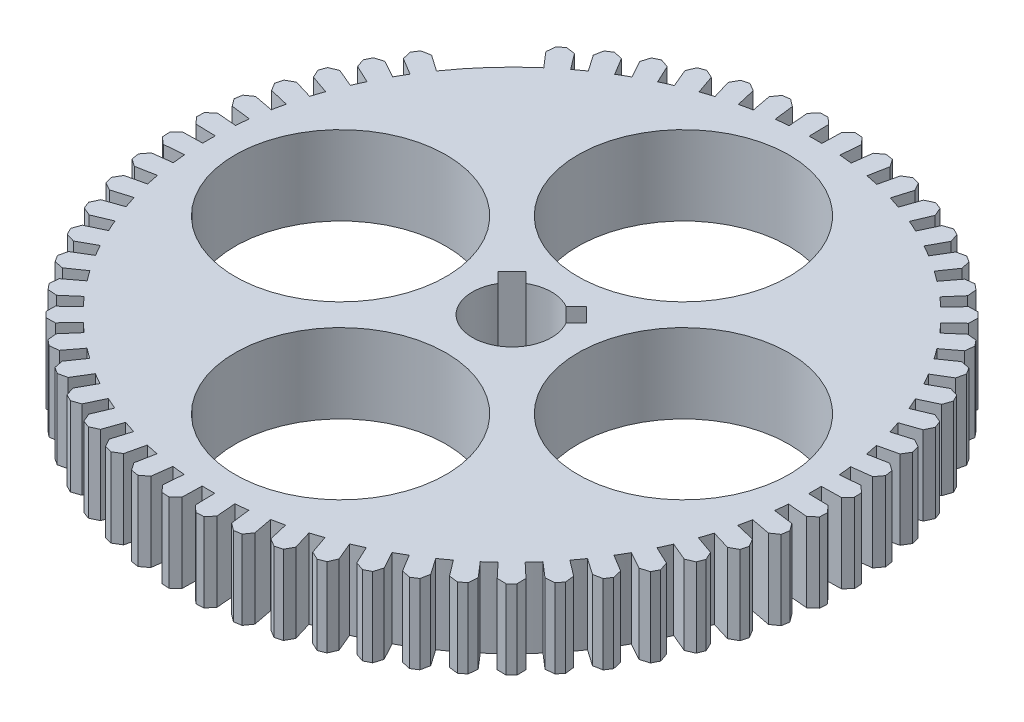
from build123d import *

# Parameters (mm, degrees)
SKETCH1_R           = 36.5125
SKETCH1_R_2         = 12.7
BOSS_EXTRUDE1_DEPTH = 9.525
EXTRUDE_THIN1_START = -9.525
EXTRUDE_THIN1_DEPTH = 9.525


# Read off the part's stored shape, not the designer's step: Extrude-Thin1
with BuildPart() as part:
    # Sketch1 → Boss-Extrude1 (new body)
    with BuildSketch(Plane(origin=(0, 0, 0), x_dir=(1, 0, 0), z_dir=(0, 1, 0))):
        with Locations(Location((0, 0, 0), (0, 0, 90))):
            Circle(SKETCH1_R)
        with Locations(Location((0, -20.6375, 0), (0, 0, 90))):
            Circle(SKETCH1_R_2, mode=Mode.SUBTRACT)
        with Locations(Location((-20.6375, 0, 0), (0, 0, 90))):
            Circle(SKETCH1_R_2, mode=Mode.SUBTRACT)
        with BuildLine():
            Line((2.418761839, 4.102559861), (3.648229049, 5.332027072))
            Line((3.648229049, 5.332027072), (5.332027072, 3.648229049))
            Line((5.332027072, 3.648229049), (4.102559861, 2.418761839))
            ThreePointArc((4.102559861, 2.418761839), (4.59455371, 1.253587833), (4.7625, 0))
            ThreePointArc((4.7625, 0), (-1.253587833, -4.59455371), (-4.102559861, 2.418761839))
            Line((-4.102559861, 2.418761839), (-5.332027072, 3.648229049))
            Line((-5.332027072, 3.648229049), (-3.648229049, 5.332027072))
            Line((-3.648229049, 5.332027072), (-2.418761839, 4.102559861))
            ThreePointArc((-2.418761839, 4.102559861), (0, 4.7625), (2.418761839, 4.102559861))
        make_face(mode=Mode.SUBTRACT)
        with Locations(Location((20.6375, 0, 0), (0, 0, 90))):
            Circle(SKETCH1_R_2, mode=Mode.SUBTRACT)
        with Locations(Location((0, 20.6375, 0), (0, 0, 90))):
            Circle(SKETCH1_R_2, mode=Mode.SUBTRACT)
    extrude(amount=BOSS_EXTRUDE1_DEPTH)

    # Extrude-Thin1 outline → Extrude-Thin1 (add)
    with BuildSketch(Plane(origin=(0, 9.525, 0), x_dir=(1, 0, 0), z_dir=(0, 1, 0)).offset(EXTRUDE_THIN1_START)):
        with BuildLine():
            Line((-17.569879945, 35.567425081), (-18.384318942, 35.153367195))
            Line((-18.384318942, 35.153367195), (-18.710040661, 34.097773645))
            Line((-18.710040661, 34.097773645), (-17.564527967, 32.01015485))
            ThreePointArc((-17.564527967, 32.01015485), (-16.547148477, 32.54772701), (-15.513335009, 33.052974044))
            Line((-15.513335009, 33.052974044), (-16.525074249, 35.208602786))
            Line((-16.525074249, 35.208602786), (-17.569879945, 35.567425081))
        make_face()
        with BuildLine():
            ThreePointArc((-20.814279941, 29.998806756), (-19.858665354, 30.639779154), (-18.88332792, 31.250321325))
            Line((-18.88332792, 31.250321325), (-20.114849306, 33.288385759))
            Line((-20.114849306, 33.288385759), (-21.191438591, 33.536030454))
            Line((-21.191438591, 33.536030454), (-21.958135171, 33.039108765))
            Line((-21.958135171, 33.039108765), (-22.17173298, 31.955250675))
            Line((-22.17173298, 31.955250675), (-20.814279941, 29.998806756))
        make_face()
        with BuildLine():
            Line((-15.04335722, 35.866714271), (-14.12233535, 33.670792989))
            ThreePointArc((-14.12233535, 33.670792989), (-13.05433758, 34.099075157), (-11.973374754, 34.493491462))
            Line((-11.973374754, 34.493491462), (-12.75424702, 36.743066992))
            Line((-12.75424702, 36.743066992), (-13.755822018, 37.209135555))
            Line((-13.755822018, 37.209135555), (-14.609080268, 36.882477979))
            Line((-14.609080268, 36.882477979), (-15.04335722, 35.866714271))
        make_face()
        with BuildLine():
            ThreePointArc((-23.835986307, 27.658785458), (-22.952606537, 28.396135466), (-22.046431139, 29.105283546))
            Line((-22.046431139, 29.105283546), (-23.484241865, 31.003454212))
            Line((-23.484241865, 31.003454212), (-24.5808194, 31.13720806))
            Line((-24.5808194, 31.13720806), (-25.291373476, 30.562866944))
            Line((-25.291373476, 30.562866944), (-25.390507154, 29.462619292))
            Line((-25.390507154, 29.462619292), (-23.835986307, 27.658785458))
        make_face()
        with BuildLine():
            Line((-11.21185561, 37.24269167), (-10.525415471, 34.962526874))
            ThreePointArc((-10.525415471, 34.962526874), (-9.418500628, 35.276826702), (-8.302231699, 35.55609097))
            Line((-8.302231699, 35.55609097), (-8.843681592, 37.874966468))
            Line((-8.843681592, 37.874966468), (-9.791052427, 38.443174954))
            Line((-9.791052427, 38.443174954), (-10.673781453, 38.207496616))
            Line((-10.673781453, 38.207496616), (-11.21185561, 37.24269167))
        make_face()
        with BuildLine():
            ThreePointArc((-31.21640485, 18.939343296), (-30.604114447, 19.913584187), (-29.961429237, 20.868047688))
            Line((-29.961429237, 20.868047688), (-31.915435492, 22.22900732))
            Line((-31.915435492, 22.22900732), (-32.999674914, 22.017353694))
            Line((-32.999674914, 22.017353694), (-33.497970833, 21.251549549))
            Line((-33.497970833, 21.251549549), (-33.25225734, 20.174517859))
            Line((-33.25225734, 20.174517859), (-31.21640485, 18.939343296))
        make_face()
        with BuildLine():
            Line((-7.257514564, 38.210630346), (-6.813176938, 35.871203998))
            ThreePointArc((-6.813176938, 35.871203998), (-5.679472612, 36.068077951), (-4.540127656, 36.229130505))
            Line((-4.540127656, 36.229130505), (-4.836222938, 38.591899885))
            Line((-4.836222938, 38.591899885), (-5.719010016, 39.256022883))
            Line((-5.719010016, 39.256022883), (-6.621538455, 39.113905924))
            Line((-6.621538455, 39.113905924), (-7.257514564, 38.210630346))
        make_face()
        with BuildLine():
            ThreePointArc((-33.025098568, 15.572588764), (-32.517998259, 16.605494437), (-31.978602349, 17.621908184))
            Line((-31.978602349, 17.621908184), (-34.064163372, 18.771163065))
            Line((-34.064163372, 18.771163065), (-35.120339389, 18.44733502))
            Line((-35.120339389, 18.44733502), (-35.53585726, 17.633639923))
            Line((-35.53585726, 17.633639923), (-35.178909344, 16.588192379))
            Line((-35.178909344, 16.588192379), (-33.025098568, 15.572588764))
        make_face()
        with BuildLine():
            Line((-3.223658669, 38.759925359), (-3.026291812, 36.386868705))
            ThreePointArc((-3.026291812, 36.386868705), (-1.878219105, 36.464159791), (-0.728281025, 36.505236104))
            Line((-0.728281025, 36.505236104), (-0.775777613, 38.886012372))
            Line((-0.775777613, 38.886012372), (-1.584308935, 39.638773611))
            Line((-1.584308935, 39.638773611), (-2.496748496, 39.591775094))
            Line((-2.496748496, 39.591775094), (-3.223658669, 38.759925359))
        make_face()
        with BuildLine():
            ThreePointArc((-34.471962395, 12.035217691), (-34.075608077, 13.115471414), (-33.645411202, 14.182699366))
            Line((-33.645411202, 14.182699366), (-35.83967715, 15.10765802))
            Line((-35.83967715, 15.10765802), (-36.856218076, 14.675203483))
            Line((-36.856218076, 14.675203483), (-37.184405399, 13.822532448))
            Line((-37.184405399, 13.822532448), (-36.720133856, 12.820123192))
            Line((-36.720133856, 12.820123192), (-34.471962395, 12.035217691))
        make_face()
        with BuildLine():
            Line((0.845516304, 38.884558519), (0.79375, 36.503871263))
            ThreePointArc((0.79375, 36.503871263), (1.943612563, 36.460732665), (3.091544806, 36.381382697))
            Line((3.091544806, 36.381382697), (3.293167294, 38.754081569))
            Line((3.293167294, 38.754081569), (2.567750166, 39.58723364))
            Line((2.567750166, 39.58723364), (1.655396362, 39.635868491))
            Line((1.655396362, 39.635868491), (0.845516304, 38.884558519))
        make_face()
        with BuildLine():
            ThreePointArc((-35.541144189, 8.365986254), (-35.259878403, 9.481752542), (-34.943593889, 10.588101926))
            Line((-34.943593889, 10.588101926), (-37.222523925, 11.278630312))
            Line((-37.222523925, 11.278630312), (-38.188292326, 10.742287345))
            Line((-38.188292326, 10.742287345), (-38.425553411, 9.859982415))
            Line((-38.425553411, 9.859982415), (-37.859044897, 8.911594053))
            Line((-37.859044897, 8.911594053), (-35.541144189, 8.365986254))
        make_face()
        with BuildLine():
            Line((4.905427624, 38.583164319), (4.605095321, 36.220929769))
            ThreePointArc((4.605095321, 36.220929769), (5.744149605, 36.057834122), (6.877499025, 35.858927248))
            Line((6.877499025, 35.858927248), (7.32603157, 38.197552939))
            Line((7.32603157, 38.197552939), (6.69167646, 39.101967653))
            Line((6.69167646, 39.101967653), (5.789404351, 39.245703018))
            Line((5.789404351, 39.245703018), (4.905427624, 38.583164319))
        make_face()
        with BuildLine():
            ThreePointArc((-36.220929769, 4.605095321), (-36.057834122, 5.744149605), (-35.858927248, 6.877499025))
            Line((-35.858927248, 6.877499025), (-38.197552939, 7.32603157))
            Line((-38.197552939, 7.32603157), (-39.101967653, 6.69167646))
            Line((-39.101967653, 6.69167646), (-39.245703018, 5.789404351))
            Line((-39.245703018, 5.789404351), (-38.583164319, 4.905427624))
            Line((-38.583164319, 4.905427624), (-36.220929769, 4.605095321))
        make_face()
        with BuildLine():
            Line((8.911594053, 37.859044897), (8.365986254, 35.541144189))
            ThreePointArc((8.365986254, 35.541144189), (9.481752542, 35.259878403), (10.588101926, 34.943593889))
            Line((10.588101926, 34.943593889), (11.278630312, 37.222523925))
            Line((11.278630312, 37.222523925), (10.742287345, 38.188292326))
            Line((10.742287345, 38.188292326), (9.859982415, 38.425553411))
            Line((9.859982415, 38.425553411), (8.911594053, 37.859044897))
        make_face()
        with BuildLine():
            ThreePointArc((-36.503871263, 0.79375), (-36.460732665, 1.943612563), (-36.381382697, 3.091544806))
            Line((-36.381382697, 3.091544806), (-38.754081569, 3.293167294))
            Line((-38.754081569, 3.293167294), (-39.58723364, 2.567750166))
            Line((-39.58723364, 2.567750166), (-39.635868491, 1.655396362))
            Line((-39.635868491, 1.655396362), (-38.884558519, 0.845516304))
            Line((-38.884558519, 0.845516304), (-36.503871263, 0.79375))
        make_face()
        with BuildLine():
            Line((12.820123192, 36.720133856), (12.035217691, 34.471962395))
            ThreePointArc((12.035217691, 34.471962395), (13.115471414, 34.075608077), (14.182699366, 33.645411202))
            Line((14.182699366, 33.645411202), (15.10765802, 35.83967715))
            Line((15.10765802, 35.83967715), (14.675203483, 36.856218076))
            Line((14.675203483, 36.856218076), (13.822532448, 37.184405399))
            Line((13.822532448, 37.184405399), (12.820123192, 36.720133856))
        make_face()
        with BuildLine():
            ThreePointArc((-36.386868705, -3.026291812), (-36.464159791, -1.878219105), (-36.505236104, -0.728281025))
            Line((-36.505236104, -0.728281025), (-38.886012372, -0.775777613))
            Line((-38.886012372, -0.775777613), (-39.638773611, -1.584308935))
            Line((-39.638773611, -1.584308935), (-39.591775094, -2.496748496))
            Line((-39.591775094, -2.496748496), (-38.759925359, -3.223658669))
            Line((-38.759925359, -3.223658669), (-36.386868705, -3.026291812))
        make_face()
        with BuildLine():
            Line((16.588192379, 35.178909344), (15.572588764, 33.025098568))
            ThreePointArc((15.572588764, 33.025098568), (16.605494437, 32.517998259), (17.621908184, 31.978602349))
            Line((17.621908184, 31.978602349), (18.771163065, 34.064163372))
            Line((18.771163065, 34.064163372), (18.44733502, 35.120339389))
            Line((18.44733502, 35.120339389), (17.633639923, 35.53585726))
            Line((17.633639923, 35.53585726), (16.588192379, 35.178909344))
        make_face()
        with BuildLine():
            ThreePointArc((-35.871203998, -6.813176938), (-36.068077951, -5.679472612), (-36.229130505, -4.540127656))
            Line((-36.229130505, -4.540127656), (-38.591899885, -4.836222938))
            Line((-38.591899885, -4.836222938), (-39.256022883, -5.719010016))
            Line((-39.256022883, -5.719010016), (-39.113905924, -6.621538455))
            Line((-39.113905924, -6.621538455), (-38.210630346, -7.257514564))
            Line((-38.210630346, -7.257514564), (-35.871203998, -6.813176938))
        make_face()
        with BuildLine():
            Line((20.174517859, 33.25225734), (18.939343296, 31.21640485))
            ThreePointArc((18.939343296, 31.21640485), (19.913584187, 30.604114447), (20.868047688, 29.961429237))
            Line((20.868047688, 29.961429237), (22.22900732, 31.915435492))
            Line((22.22900732, 31.915435492), (22.017353694, 32.999674914))
            Line((22.017353694, 32.999674914), (21.251549549, 33.497970833))
            Line((21.251549549, 33.497970833), (20.174517859, 33.25225734))
        make_face()
        with BuildLine():
            ThreePointArc((-34.962526874, -10.525415471), (-35.276826702, -9.418500628), (-35.55609097, -8.302231699))
            Line((-35.55609097, -8.302231699), (-37.874966468, -8.843681592))
            Line((-37.874966468, -8.843681592), (-38.443174954, -9.791052427))
            Line((-38.443174954, -9.791052427), (-38.207496616, -10.673781453))
            Line((-38.207496616, -10.673781453), (-37.24269167, -11.21185561))
            Line((-37.24269167, -11.21185561), (-34.962526874, -10.525415471))
        make_face()
        with BuildLine():
            Line((23.539807099, 30.961286647), (22.098594419, 29.065697668))
            ThreePointArc((22.098594419, 29.065697668), (23.003496542, 28.354925552), (23.885552495, 27.615992437))
            Line((23.885552495, 27.615992437), (25.443305918, 29.417035422))
            Line((25.443305918, 29.417035422), (25.346145634, 30.517459095))
            Line((25.346145634, 30.517459095), (24.63662275, 31.093073628))
            Line((24.63662275, 31.093073628), (23.539807099, 30.961286647))
        make_face()
        with BuildLine():
            ThreePointArc((-33.670792989, -14.12233535), (-34.099075157, -13.05433758), (-34.493491462, -11.973374754))
            Line((-34.493491462, -11.973374754), (-36.743066992, -12.75424702))
            Line((-36.743066992, -12.75424702), (-37.209135555, -13.755822018))
            Line((-37.209135555, -13.755822018), (-36.882477979, -14.609080268))
            Line((-36.882477979, -14.609080268), (-35.866714271, -15.04335722))
            Line((-35.866714271, -15.04335722), (-33.670792989, -14.12233535))
        make_face()
        with BuildLine():
            Line((26.647189286, 28.331097617), (25.015728718, 26.59654062))
            ThreePointArc((25.015728718, 26.59654062), (25.841377775, 25.79507416), (26.64136219, 24.967989044))
            Line((26.64136219, 24.967989044), (28.378842333, 26.596336156))
            Line((28.378842333, 26.596336156), (28.397239899, 27.700887608))
            Line((28.397239899, 27.700887608), (27.751771958, 28.347514201))
            Line((27.751771958, 28.347514201), (26.647189286, 28.331097617))
        make_face()
        with BuildLine():
            ThreePointArc((-32.01015485, -17.564527967), (-32.54772701, -16.547148477), (-33.052974044, -15.513335009))
            Line((-33.052974044, -15.513335009), (-35.208602786, -16.525074249))
            Line((-35.208602786, -16.525074249), (-35.567425081, -17.569879945))
            Line((-35.567425081, -17.569879945), (-35.153367195, -18.384318942))
            Line((-35.153367195, -18.384318942), (-34.097773645, -18.710040661))
            Line((-34.097773645, -18.710040661), (-32.01015485, -17.564527967))
        make_face()
        with BuildLine():
            Line((29.462619292, 25.390507154), (27.658785458, 23.835986307))
            ThreePointArc((27.658785458, 23.835986307), (28.396135466, 22.952606537), (29.105283546, 22.046431139))
            Line((29.105283546, 22.046431139), (31.003454212, 23.484241865))
            Line((31.003454212, 23.484241865), (31.13720806, 24.5808194))
            Line((31.13720806, 24.5808194), (30.562866944, 25.291373476))
            Line((30.562866944, 25.291373476), (29.462619292, 25.390507154))
        make_face()
        with BuildLine():
            ThreePointArc((-29.998806756, -20.814279941), (-30.639779154, -19.858665354), (-31.250321325, -18.88332792))
            Line((-31.250321325, -18.88332792), (-33.288385759, -20.114849306))
            Line((-33.288385759, -20.114849306), (-33.536030454, -21.191438591))
            Line((-33.536030454, -21.191438591), (-33.039108765, -21.958135171))
            Line((-33.039108765, -21.958135171), (-31.955250675, -22.17173298))
            Line((-31.955250675, -22.17173298), (-29.998806756, -20.814279941))
        make_face()
        with BuildLine():
            Line((31.955250675, 22.17173298), (29.998806756, 20.814279941))
            ThreePointArc((29.998806756, 20.814279941), (30.639779154, 19.858665354), (31.250321325, 18.88332792))
            Line((31.250321325, 18.88332792), (33.288385759, 20.114849306))
            Line((33.288385759, 20.114849306), (33.536030454, 21.191438591))
            Line((33.536030454, 21.191438591), (33.039108765, 21.958135171))
            Line((33.039108765, 21.958135171), (31.955250675, 22.17173298))
        make_face()
        with BuildLine():
            ThreePointArc((-27.658785458, -23.835986307), (-28.396135466, -22.952606537), (-29.105283546, -22.046431139))
            Line((-29.105283546, -22.046431139), (-31.003454212, -23.484241865))
            Line((-31.003454212, -23.484241865), (-31.13720806, -24.5808194))
            Line((-31.13720806, -24.5808194), (-30.562866944, -25.291373476))
            Line((-30.562866944, -25.291373476), (-29.462619292, -25.390507154))
            Line((-29.462619292, -25.390507154), (-27.658785458, -23.835986307))
        make_face()
        with BuildLine():
            Line((34.097773645, 18.710040661), (32.01015485, 17.564527967))
            ThreePointArc((32.01015485, 17.564527967), (32.54772701, 16.547148477), (33.052974044, 15.513335009))
            Line((33.052974044, 15.513335009), (35.208602786, 16.525074249))
            Line((35.208602786, 16.525074249), (35.567425081, 17.569879945))
            Line((35.567425081, 17.569879945), (35.153367195, 18.384318942))
            Line((35.153367195, 18.384318942), (34.097773645, 18.710040661))
        make_face()
        with BuildLine():
            ThreePointArc((-25.015728718, -26.59654062), (-25.841377775, -25.79507416), (-26.64136219, -24.967989044))
            Line((-26.64136219, -24.967989044), (-28.378842333, -26.596336156))
            Line((-28.378842333, -26.596336156), (-28.397239899, -27.700887608))
            Line((-28.397239899, -27.700887608), (-27.751771958, -28.347514201))
            Line((-27.751771958, -28.347514201), (-26.647189286, -28.331097617))
            Line((-26.647189286, -28.331097617), (-25.015728718, -26.59654062))
        make_face()
        with BuildLine():
            Line((35.866714271, 15.04335722), (33.670792989, 14.12233535))
            ThreePointArc((33.670792989, 14.12233535), (34.099075157, 13.05433758), (34.493491462, 11.973374754))
            Line((34.493491462, 11.973374754), (36.743066992, 12.75424702))
            Line((36.743066992, 12.75424702), (37.209135555, 13.755822018))
            Line((37.209135555, 13.755822018), (36.882477979, 14.609080268))
            Line((36.882477979, 14.609080268), (35.866714271, 15.04335722))
        make_face()
        with BuildLine():
            ThreePointArc((-22.098594419, -29.065697668), (-23.003496542, -28.354925552), (-23.885552495, -27.615992437))
            Line((-23.885552495, -27.615992437), (-25.443305918, -29.417035422))
            Line((-25.443305918, -29.417035422), (-25.346145634, -30.517459095))
            Line((-25.346145634, -30.517459095), (-24.63662275, -31.093073628))
            Line((-24.63662275, -31.093073628), (-23.539807099, -30.961286647))
            Line((-23.539807099, -30.961286647), (-22.098594419, -29.065697668))
        make_face()
        with BuildLine():
            Line((37.24269167, 11.21185561), (34.962526874, 10.525415471))
            ThreePointArc((34.962526874, 10.525415471), (35.276826702, 9.418500628), (35.55609097, 8.302231699))
            Line((35.55609097, 8.302231699), (37.874966468, 8.843681592))
            Line((37.874966468, 8.843681592), (38.443174954, 9.791052427))
            Line((38.443174954, 9.791052427), (38.207496616, 10.673781453))
            Line((38.207496616, 10.673781453), (37.24269167, 11.21185561))
        make_face()
        with BuildLine():
            ThreePointArc((-18.939343296, -31.21640485), (-19.913584187, -30.604114447), (-20.868047688, -29.961429237))
            Line((-20.868047688, -29.961429237), (-22.22900732, -31.915435492))
            Line((-22.22900732, -31.915435492), (-22.017353694, -32.999674914))
            Line((-22.017353694, -32.999674914), (-21.251549549, -33.497970833))
            Line((-21.251549549, -33.497970833), (-20.174517859, -33.25225734))
            Line((-20.174517859, -33.25225734), (-18.939343296, -31.21640485))
        make_face()
        with BuildLine():
            Line((38.210630346, 7.257514564), (35.871203998, 6.813176938))
            ThreePointArc((35.871203998, 6.813176938), (36.068077951, 5.679472612), (36.229130505, 4.540127656))
            Line((36.229130505, 4.540127656), (38.591899885, 4.836222938))
            Line((38.591899885, 4.836222938), (39.256022883, 5.719010016))
            Line((39.256022883, 5.719010016), (39.113905924, 6.621538455))
            Line((39.113905924, 6.621538455), (38.210630346, 7.257514564))
        make_face()
        with BuildLine():
            ThreePointArc((-15.572588764, -33.025098568), (-16.605494437, -32.517998259), (-17.621908184, -31.978602349))
            Line((-17.621908184, -31.978602349), (-18.771163065, -34.064163372))
            Line((-18.771163065, -34.064163372), (-18.44733502, -35.120339389))
            Line((-18.44733502, -35.120339389), (-17.633639923, -35.53585726))
            Line((-17.633639923, -35.53585726), (-16.588192379, -35.178909344))
            Line((-16.588192379, -35.178909344), (-15.572588764, -33.025098568))
        make_face()
        with BuildLine():
            Line((38.759925359, 3.223658669), (36.386868705, 3.026291812))
            ThreePointArc((36.386868705, 3.026291812), (36.464159791, 1.878219105), (36.505236104, 0.728281025))
            Line((36.505236104, 0.728281025), (38.886012372, 0.775777613))
            Line((38.886012372, 0.775777613), (39.638773611, 1.584308935))
            Line((39.638773611, 1.584308935), (39.591775094, 2.496748496))
            Line((39.591775094, 2.496748496), (38.759925359, 3.223658669))
        make_face()
        with BuildLine():
            ThreePointArc((-12.035217691, -34.471962395), (-13.115471414, -34.075608077), (-14.182699366, -33.645411202))
            Line((-14.182699366, -33.645411202), (-15.10765802, -35.83967715))
            Line((-15.10765802, -35.83967715), (-14.675203483, -36.856218076))
            Line((-14.675203483, -36.856218076), (-13.822532448, -37.184405399))
            Line((-13.822532448, -37.184405399), (-12.820123192, -36.720133856))
            Line((-12.820123192, -36.720133856), (-12.035217691, -34.471962395))
        make_face()
        with BuildLine():
            Line((38.884558519, -0.845516304), (36.503871263, -0.79375))
            ThreePointArc((36.503871263, -0.79375), (36.460732665, -1.943612563), (36.381382697, -3.091544806))
            Line((36.381382697, -3.091544806), (38.754081569, -3.293167294))
            Line((38.754081569, -3.293167294), (39.58723364, -2.567750166))
            Line((39.58723364, -2.567750166), (39.635868491, -1.655396362))
            Line((39.635868491, -1.655396362), (38.884558519, -0.845516304))
        make_face()
        with BuildLine():
            ThreePointArc((-8.365986254, -35.541144189), (-9.481752542, -35.259878403), (-10.588101926, -34.943593889))
            Line((-10.588101926, -34.943593889), (-11.278630312, -37.222523925))
            Line((-11.278630312, -37.222523925), (-10.742287345, -38.188292326))
            Line((-10.742287345, -38.188292326), (-9.859982415, -38.425553411))
            Line((-9.859982415, -38.425553411), (-8.911594053, -37.859044897))
            Line((-8.911594053, -37.859044897), (-8.365986254, -35.541144189))
        make_face()
        with BuildLine():
            Line((38.583164319, -4.905427624), (36.220929769, -4.605095321))
            ThreePointArc((36.220929769, -4.605095321), (36.057834122, -5.744149605), (35.858927248, -6.877499025))
            Line((35.858927248, -6.877499025), (38.197552939, -7.32603157))
            Line((38.197552939, -7.32603157), (39.101967653, -6.69167646))
            Line((39.101967653, -6.69167646), (39.245703018, -5.789404351))
            Line((39.245703018, -5.789404351), (38.583164319, -4.905427624))
        make_face()
        with BuildLine():
            ThreePointArc((-4.605095321, -36.220929769), (-5.744149605, -36.057834122), (-6.877499025, -35.858927248))
            Line((-6.877499025, -35.858927248), (-7.32603157, -38.197552939))
            Line((-7.32603157, -38.197552939), (-6.69167646, -39.101967653))
            Line((-6.69167646, -39.101967653), (-5.789404351, -39.245703018))
            Line((-5.789404351, -39.245703018), (-4.905427624, -38.583164319))
            Line((-4.905427624, -38.583164319), (-4.605095321, -36.220929769))
        make_face()
        with BuildLine():
            Line((37.859044897, -8.911594053), (35.541144189, -8.365986254))
            ThreePointArc((35.541144189, -8.365986254), (35.259878403, -9.481752542), (34.943593889, -10.588101926))
            Line((34.943593889, -10.588101926), (37.222523925, -11.278630312))
            Line((37.222523925, -11.278630312), (38.188292326, -10.742287345))
            Line((38.188292326, -10.742287345), (38.425553411, -9.859982415))
            Line((38.425553411, -9.859982415), (37.859044897, -8.911594053))
        make_face()
        with BuildLine():
            ThreePointArc((-0.79375, -36.503871263), (-1.943612563, -36.460732665), (-3.091544806, -36.381382697))
            Line((-3.091544806, -36.381382697), (-3.293167294, -38.754081569))
            Line((-3.293167294, -38.754081569), (-2.567750166, -39.58723364))
            Line((-2.567750166, -39.58723364), (-1.655396362, -39.635868491))
            Line((-1.655396362, -39.635868491), (-0.845516304, -38.884558519))
            Line((-0.845516304, -38.884558519), (-0.79375, -36.503871263))
        make_face()
        with BuildLine():
            Line((36.720133856, -12.820123192), (34.471962395, -12.035217691))
            ThreePointArc((34.471962395, -12.035217691), (34.075608077, -13.115471414), (33.645411202, -14.182699366))
            Line((33.645411202, -14.182699366), (35.83967715, -15.10765802))
            Line((35.83967715, -15.10765802), (36.856218076, -14.675203483))
            Line((36.856218076, -14.675203483), (37.184405399, -13.822532448))
            Line((37.184405399, -13.822532448), (36.720133856, -12.820123192))
        make_face()
        with BuildLine():
            ThreePointArc((3.026291812, -36.386868705), (1.878219105, -36.464159791), (0.728281025, -36.505236104))
            Line((0.728281025, -36.505236104), (0.775777613, -38.886012372))
            Line((0.775777613, -38.886012372), (1.584308935, -39.638773611))
            Line((1.584308935, -39.638773611), (2.496748496, -39.591775094))
            Line((2.496748496, -39.591775094), (3.223658669, -38.759925359))
            Line((3.223658669, -38.759925359), (3.026291812, -36.386868705))
        make_face()
        with BuildLine():
            Line((35.178909344, -16.588192379), (33.025098568, -15.572588764))
            ThreePointArc((33.025098568, -15.572588764), (32.517998259, -16.605494437), (31.978602349, -17.621908184))
            Line((31.978602349, -17.621908184), (34.064163372, -18.771163065))
            Line((34.064163372, -18.771163065), (35.120339389, -18.44733502))
            Line((35.120339389, -18.44733502), (35.53585726, -17.633639923))
            Line((35.53585726, -17.633639923), (35.178909344, -16.588192379))
        make_face()
        with BuildLine():
            ThreePointArc((6.813176938, -35.871203998), (5.679472612, -36.068077951), (4.540127656, -36.229130505))
            Line((4.540127656, -36.229130505), (4.836222938, -38.591899885))
            Line((4.836222938, -38.591899885), (5.719010016, -39.256022883))
            Line((5.719010016, -39.256022883), (6.621538455, -39.113905924))
            Line((6.621538455, -39.113905924), (7.257514564, -38.210630346))
            Line((7.257514564, -38.210630346), (6.813176938, -35.871203998))
        make_face()
        with BuildLine():
            Line((33.25225734, -20.174517859), (31.21640485, -18.939343296))
            ThreePointArc((31.21640485, -18.939343296), (30.604114447, -19.913584187), (29.961429237, -20.868047688))
            Line((29.961429237, -20.868047688), (31.915435492, -22.22900732))
            Line((31.915435492, -22.22900732), (32.999674914, -22.017353694))
            Line((32.999674914, -22.017353694), (33.497970833, -21.251549549))
            Line((33.497970833, -21.251549549), (33.25225734, -20.174517859))
        make_face()
        with BuildLine():
            ThreePointArc((10.525415471, -34.962526874), (9.418500628, -35.276826702), (8.302231699, -35.55609097))
            Line((8.302231699, -35.55609097), (8.843681592, -37.874966468))
            Line((8.843681592, -37.874966468), (9.791052427, -38.443174954))
            Line((9.791052427, -38.443174954), (10.673781453, -38.207496616))
            Line((10.673781453, -38.207496616), (11.21185561, -37.24269167))
            Line((11.21185561, -37.24269167), (10.525415471, -34.962526874))
        make_face()
        with BuildLine():
            Line((30.961286647, -23.539807099), (29.065697668, -22.098594419))
            ThreePointArc((29.065697668, -22.098594419), (28.354925552, -23.003496542), (27.615992437, -23.885552495))
            Line((27.615992437, -23.885552495), (29.417035422, -25.443305918))
            Line((29.417035422, -25.443305918), (30.517459095, -25.346145634))
            Line((30.517459095, -25.346145634), (31.093073628, -24.63662275))
            Line((31.093073628, -24.63662275), (30.961286647, -23.539807099))
        make_face()
        with BuildLine():
            ThreePointArc((14.12233535, -33.670792989), (13.05433758, -34.099075157), (11.973374754, -34.493491462))
            Line((11.973374754, -34.493491462), (12.75424702, -36.743066992))
            Line((12.75424702, -36.743066992), (13.755822018, -37.209135555))
            Line((13.755822018, -37.209135555), (14.609080268, -36.882477979))
            Line((14.609080268, -36.882477979), (15.04335722, -35.866714271))
            Line((15.04335722, -35.866714271), (14.12233535, -33.670792989))
        make_face()
        with BuildLine():
            Line((28.331097617, -26.647189286), (26.59654062, -25.015728718))
            ThreePointArc((26.59654062, -25.015728718), (25.79507416, -25.841377775), (24.967989044, -26.64136219))
            Line((24.967989044, -26.64136219), (26.596336156, -28.378842333))
            Line((26.596336156, -28.378842333), (27.700887608, -28.397239899))
            Line((27.700887608, -28.397239899), (28.347514201, -27.751771958))
            Line((28.347514201, -27.751771958), (28.331097617, -26.647189286))
        make_face()
        with BuildLine():
            ThreePointArc((17.564527967, -32.01015485), (16.547148477, -32.54772701), (15.513335009, -33.052974044))
            Line((15.513335009, -33.052974044), (16.525074249, -35.208602786))
            Line((16.525074249, -35.208602786), (17.569879945, -35.567425081))
            Line((17.569879945, -35.567425081), (18.384318942, -35.153367195))
            Line((18.384318942, -35.153367195), (18.710040661, -34.097773645))
            Line((18.710040661, -34.097773645), (17.564527967, -32.01015485))
        make_face()
        with BuildLine():
            Line((25.390507154, -29.462619292), (23.835986307, -27.658785458))
            ThreePointArc((23.835986307, -27.658785458), (22.952606537, -28.396135466), (22.046431139, -29.105283546))
            Line((22.046431139, -29.105283546), (23.484241865, -31.003454212))
            Line((23.484241865, -31.003454212), (24.5808194, -31.13720806))
            Line((24.5808194, -31.13720806), (25.291373476, -30.562866944))
            Line((25.291373476, -30.562866944), (25.390507154, -29.462619292))
        make_face()
        with BuildLine():
            ThreePointArc((20.814279941, -29.998806756), (19.858665354, -30.639779154), (18.88332792, -31.250321325))
            Line((18.88332792, -31.250321325), (20.114849306, -33.288385759))
            Line((20.114849306, -33.288385759), (21.191438591, -33.536030454))
            Line((21.191438591, -33.536030454), (21.958135171, -33.039108765))
            Line((21.958135171, -33.039108765), (22.17173298, -31.955250675))
            Line((22.17173298, -31.955250675), (20.814279941, -29.998806756))
        make_face()
    extrude(amount=EXTRUDE_THIN1_DEPTH)


solid = part.part
